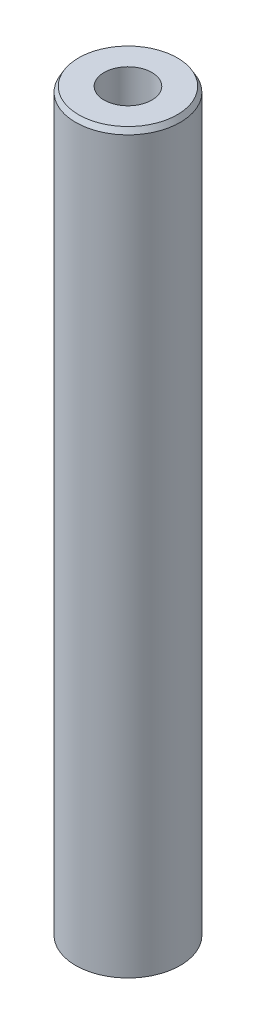
from build123d import *
from OCP.BRepFilletAPI import BRepFilletAPI_MakeChamfer

# Parameters (mm, degrees)
SKETCH1_R           = 42.5
BOSS_EXTRUDE1_DEPTH = 600
SKETCH2_R           = 19.449556089
CUT_EXTRUDE1_DEPTH  = 604.002902149
CHAMFER1_SIZE       = 4.169020836
CHAMFER1_SIZE2      = 2.406985302


with BuildPart() as part:
    # Sketch1 → Boss-Extrude1 (new body)
    with BuildSketch(Plane(origin=(0, 0, 0), x_dir=(1, 0, 0), z_dir=(0, 1, 0))):
        Circle(SKETCH1_R)
    extrude(amount=BOSS_EXTRUDE1_DEPTH)

    # Sketch2 → Cut-Extrude1 (cut, through all)
    with BuildSketch(Plane(origin=(0, 0, 0), x_dir=(1, 0, 0), z_dir=(0, 1, 0))):
        Circle(SKETCH2_R)
    extrude(amount=CUT_EXTRUDE1_DEPTH, mode=Mode.SUBTRACT)

    # Chamfer1: one chamfer whose edges measure the first distance from different faces: ONE call of the kernel's chamfer builder (chamfer() names one face for all edges)
    chamfer1_edges_1 = [part.edges().sort_by_distance(p)[0] for p in [
        (-42.5, 600, 0),
    ]]
    chamfer1_side_1 = [part.faces().sort_by_distance(p)[0] for p in [
        (-42.5, 300, 0),
    ]]
    chamfer1_edges_2 = [part.edges().sort_by_distance(p)[0] for p in [
        (-42.5, 0, 0),
    ]]
    chamfer1_side_2 = [part.faces().sort_by_distance(p)[0] for p in [
        (-41.297918472, 0, 0),
    ]]
    chamfer1 = BRepFilletAPI_MakeChamfer(part.part.solid().wrapped)
    for e in chamfer1_edges_1:
        chamfer1.Add(CHAMFER1_SIZE, CHAMFER1_SIZE2, e.wrapped, chamfer1_side_1[0].wrapped)  # the first distance lies on this face
    for e in chamfer1_edges_2:
        chamfer1.Add(CHAMFER1_SIZE, CHAMFER1_SIZE2, e.wrapped, chamfer1_side_2[0].wrapped)  # the first distance lies on this face
    add(Compound.cast(chamfer1.Shape()), mode=Mode.REPLACE)


solid = part.part
